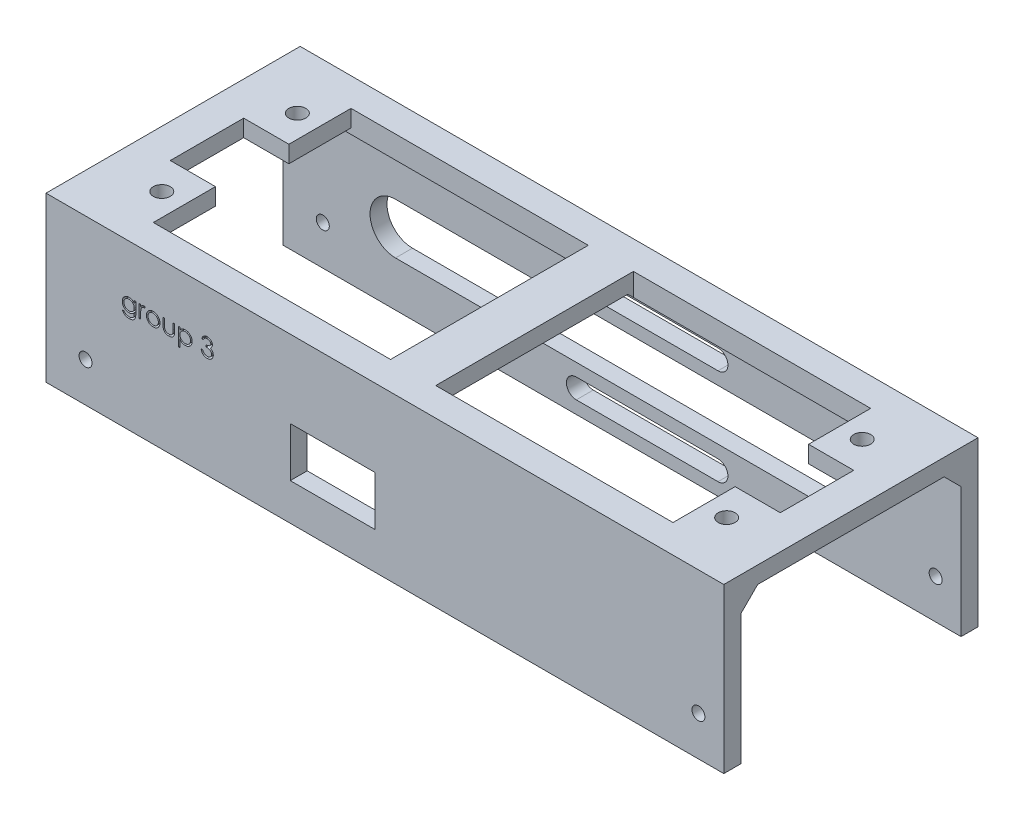
from build123d import *

# Parameters (mm, degrees)
SKETCH1_W           = 120
SKETCH1_H           = 29
BOSS_EXTRUDE5_DEPTH = 45
SHELL9_T            = -3
SKETCH3_R           = 1.15
CUT_EXTRUDE2_DEPTH  = 79
CUT_EXTRUDE8_DEPTH  = 23
SKETCH7_W           = 15
SKETCH7_H           = 8.75
CUT_EXTRUDE9_DEPTH  = 20
SKETCH13_W          = 50
SKETCH13_H          = 35
CUT_EXTRUDE14_DEPTH = 10
CHAMFER2_SIZE       = 3
SKETCH17_W          = 8
SKETCH17_H          = 11
SKETCH17_R          = 1.5
BOSS_EXTRUDE6_DEPTH = 3
CUT_EXTRUDE15_DEPTH = 1.5


with BuildPart() as part:
    # Sketch1 → Boss-Extrude5 (new body)
    with BuildSketch(Plane.XY):
        with Locations((60, 14.5)):
            Rectangle(SKETCH1_W, SKETCH1_H)
    extrude(amount=BOSS_EXTRUDE5_DEPTH)

    # Shell9
    shell9_openings = [part.faces().sort_by_distance(p)[0] for p in [
        (0, 14.5, 22.5),
        (60, 0, 22.5),
        (120, 14.5, 22.5),
    ]]
    offset(amount=SHELL9_T, openings=shell9_openings, kind=Kind.INTERSECTION)

    # Sketch3 → Cut-Extrude2 (cut)
    with BuildSketch(Plane(origin=(0, 0, 0), x_dir=(-1, 0, 0), z_dir=(0, 0, -1))):
        with Locations((-7, 7)):
            Circle(SKETCH3_R)
        with Locations((-115.5, 7)):
            Circle(SKETCH3_R)
    extrude(amount=-CUT_EXTRUDE2_DEPTH, mode=Mode.SUBTRACT)

    # Sketch6 → Cut-Extrude8 (cut)
    with BuildSketch(Plane(origin=(0, 0, 0), x_dir=(-1, 0, 0), z_dir=(0, 0, -1))):
        with BuildLine():
            Line((-76.973496676, 22.75), (-51.883496676, 22.75))
            ThreePointArc((-51.883496676, 22.75), (-50.133496676, 21), (-51.883496676, 19.25))
            Line((-51.883496676, 19.25), (-76.973496676, 19.25))
            ThreePointArc((-76.973496676, 19.25), (-78.723496676, 21), (-76.973496676, 22.75))
        make_face()
        with BuildLine():
            Line((-94.873496676, 17), (-19.873496676, 17))
            ThreePointArc((-19.873496676, 17), (-15.373496676, 12.5), (-19.873496676, 8))
            Line((-19.873496676, 8), (-94.873496676, 8))
            ThreePointArc((-94.873496676, 8), (-99.373496676, 12.5), (-94.873496676, 17))
        make_face()
        with BuildLine():
            Line((-76.973496676, 2.25), (-51.883496676, 2.25))
            ThreePointArc((-51.883496676, 2.25), (-50.133496676, 4), (-51.883496676, 5.75))
            Line((-51.883496676, 5.75), (-76.973496676, 5.75))
            ThreePointArc((-76.973496676, 5.75), (-78.723496676, 4), (-76.973496676, 2.25))
        make_face()
    extrude(amount=-CUT_EXTRUDE8_DEPTH, mode=Mode.SUBTRACT)

    # Sketch7 → Cut-Extrude9 (cut)
    with BuildSketch(Plane.XY.offset(45)):
        with Locations((50.746172795, 10.921245049)):
            Rectangle(SKETCH7_W, SKETCH7_H)
    extrude(amount=-CUT_EXTRUDE9_DEPTH, mode=Mode.SUBTRACT)

    # Sketch13 → Cut-Extrude14 (cut)
    with BuildSketch(Plane(origin=(0, 29, 0), x_dir=(1, 0, 0), z_dir=(0, 1, 0))):
        with Locations((89, -22.5)):
            Rectangle(SKETCH13_W, SKETCH13_H)
        with Locations((31, -22.5)):
            Rectangle(SKETCH13_W, SKETCH13_H)
    extrude(amount=-CUT_EXTRUDE14_DEPTH, mode=Mode.SUBTRACT)

    # Chamfer2
    # the kernel refuses this chamfer: 3 mm, written as the material it adds along each edge
    with BuildSketch(Plane(origin=(120, 26, 42), x_dir=(0, 0.027495876610586768, -0.9996219169112968), z_dir=(-1, 0, 0))) as chamfer2_piece_1_section:
        Polygon((CHAMFER2_SIZE * 0.999621916911, CHAMFER2_SIZE * 0.0274958766106), (-CHAMFER2_SIZE * 0.0274958766106, CHAMFER2_SIZE * 0.999621916911), (0, 0), align=None)
    chamfer2_piece_1 = extrude(amount=127.715048964, mode=Mode.PRIVATE)
    chamfer2_piece_1 = split(chamfer2_piece_1, bisect_by=Plane(origin=(114, 25.666666667, 39.666666667), z_dir=(1, 0, 0)), keep=Keep.TOP, mode=Mode.PRIVATE)
    add(chamfer2_piece_1)
    with BuildSketch(Plane(origin=(127.715048964, 26, 42), x_dir=(0, 0.027495876610586768, -0.9996219169112968), z_dir=(-1, 0, 0))) as chamfer2_piece_2_section:
        Polygon((CHAMFER2_SIZE * 0.999621916911, CHAMFER2_SIZE * 0.0274958766106), (-CHAMFER2_SIZE * 0.0274958766106, CHAMFER2_SIZE * 0.999621916911), (0, 0), align=None)
    chamfer2_piece_2 = extrude(amount=127.715048964, mode=Mode.PRIVATE)
    chamfer2_piece_2 = split(chamfer2_piece_2, bisect_by=Plane(origin=(114, 24.916666667, 41.166666667), z_dir=(-1, 0, 0)), keep=Keep.TOP, mode=Mode.PRIVATE)
    chamfer2_piece_2 = split(chamfer2_piece_2, bisect_by=Plane(origin=(89, 24.916666667, 40), z_dir=(0, 0, 1)), keep=Keep.TOP, mode=Mode.PRIVATE)
    add(chamfer2_piece_2)
    with BuildSketch(Plane(origin=(127.715048964, 26, 42), x_dir=(0, 0.027495876610586768, -0.9996219169112968), z_dir=(-1, 0, 0))) as chamfer2_piece_3_section:
        Polygon((CHAMFER2_SIZE * 0.999621916911, CHAMFER2_SIZE * 0.0274958766106), (-CHAMFER2_SIZE * 0.0274958766106, CHAMFER2_SIZE * 0.999621916911), (0, 0), align=None)
    chamfer2_piece_3 = extrude(amount=135.430097928, mode=Mode.PRIVATE)
    chamfer2_piece_3 = split(chamfer2_piece_3, bisect_by=Plane(origin=(64, 25.666666667, 39.666666667), z_dir=(-1, 0, 0)), keep=Keep.TOP, mode=Mode.PRIVATE)
    chamfer2_piece_3 = split(chamfer2_piece_3, bisect_by=Plane(origin=(56, 25.666666667, 39.666666667), z_dir=(1, 0, 0)), keep=Keep.TOP, mode=Mode.PRIVATE)
    add(chamfer2_piece_3)
    with BuildSketch(Plane(origin=(127.715048964, 26, 42), x_dir=(0, 0.027495876610586768, -0.9996219169112968), z_dir=(-1, 0, 0))) as chamfer2_piece_4_section:
        Polygon((CHAMFER2_SIZE * 0.999621916911, CHAMFER2_SIZE * 0.0274958766106), (-CHAMFER2_SIZE * 0.0274958766106, CHAMFER2_SIZE * 0.999621916911), (0, 0), align=None)
    chamfer2_piece_4 = extrude(amount=127.715048964, mode=Mode.PRIVATE)
    chamfer2_piece_4 = split(chamfer2_piece_4, bisect_by=Plane(origin=(6, 25.666666667, 39.666666667), z_dir=(-1, 0, 0)), keep=Keep.TOP, mode=Mode.PRIVATE)
    add(chamfer2_piece_4)
    with BuildSketch(Plane(origin=(120, 26, 3), x_dir=(0, -0.9996219169112968, -0.027495876610586334), z_dir=(-1, 0, 0))) as chamfer2_piece_5_section:
        Polygon((CHAMFER2_SIZE * 0.999621916911, CHAMFER2_SIZE * 0.0274958766106), (-CHAMFER2_SIZE * 0.0274958766106, CHAMFER2_SIZE * 0.999621916911), (0, 0), align=None)
    chamfer2_piece_5 = extrude(amount=120, mode=Mode.PRIVATE)
    chamfer2_piece_5 = split(chamfer2_piece_5, bisect_by=Plane(origin=(117, 24.916666667, 5), z_dir=(0, 0, -1)), keep=Keep.TOP, mode=Mode.PRIVATE)
    add(chamfer2_piece_5)
    with BuildSketch(Plane(origin=(120, 26, 3), x_dir=(0, -0.9996219169112968, -0.027495876610586334), z_dir=(-1, 0, 0))) as chamfer2_piece_6_section:
        Polygon((CHAMFER2_SIZE * 0.999621916911, CHAMFER2_SIZE * 0.0274958766106), (-CHAMFER2_SIZE * 0.0274958766106, CHAMFER2_SIZE * 0.999621916911), (0, 0), align=None)
    chamfer2_piece_6 = extrude(amount=127.715048964, mode=Mode.PRIVATE)
    chamfer2_piece_6 = split(chamfer2_piece_6, bisect_by=Plane(origin=(114, 25.666666667, 5.333333333), z_dir=(1, 0, 0)), keep=Keep.TOP, mode=Mode.PRIVATE)
    add(chamfer2_piece_6)
    with BuildSketch(Plane(origin=(127.715048964, 26, 3), x_dir=(0, -0.9996219169112968, -0.027495876610586334), z_dir=(-1, 0, 0))) as chamfer2_piece_7_section:
        Polygon((CHAMFER2_SIZE * 0.999621916911, CHAMFER2_SIZE * 0.0274958766106), (-CHAMFER2_SIZE * 0.0274958766106, CHAMFER2_SIZE * 0.999621916911), (0, 0), align=None)
    chamfer2_piece_7 = extrude(amount=135.430097928, mode=Mode.PRIVATE)
    chamfer2_piece_7 = split(chamfer2_piece_7, bisect_by=Plane(origin=(64, 25.666666667, 5.333333333), z_dir=(-1, 0, 0)), keep=Keep.TOP, mode=Mode.PRIVATE)
    chamfer2_piece_7 = split(chamfer2_piece_7, bisect_by=Plane(origin=(56, 25.666666667, 5.333333333), z_dir=(1, 0, 0)), keep=Keep.TOP, mode=Mode.PRIVATE)
    add(chamfer2_piece_7)
    with BuildSketch(Plane(origin=(127.715048964, 26, 3), x_dir=(0, -0.9996219169112968, -0.027495876610586334), z_dir=(-1, 0, 0))) as chamfer2_piece_8_section:
        Polygon((CHAMFER2_SIZE * 0.999621916911, CHAMFER2_SIZE * 0.0274958766106), (-CHAMFER2_SIZE * 0.0274958766106, CHAMFER2_SIZE * 0.999621916911), (0, 0), align=None)
    chamfer2_piece_8 = extrude(amount=127.715048964, mode=Mode.PRIVATE)
    chamfer2_piece_8 = split(chamfer2_piece_8, bisect_by=Plane(origin=(6, 25.666666667, 5.333333333), z_dir=(-1, 0, 0)), keep=Keep.TOP, mode=Mode.PRIVATE)
    add(chamfer2_piece_8)

    # Sketch17 → Boss-Extrude6 (add)
    # profile 1 of 4: a face of its own
    with BuildSketch(Plane(origin=(0, 29, 0), x_dir=(1, 0, 0), z_dir=(0, 1, 0))):
        with Locations((10, -10.5)):
            Rectangle(SKETCH17_W, SKETCH17_H)
        with Locations(Location((10, -10.5, 0), (0, 0, 270))):
            Circle(SKETCH17_R, mode=Mode.SUBTRACT)
    # profile 2 of 4: a face of its own
    with BuildSketch(Plane(origin=(0, 29, 0), x_dir=(1, 0, 0), z_dir=(0, 1, 0))):
        with Locations((10, -34.5)):
            Rectangle(SKETCH17_W, SKETCH17_H)
        with Locations(Location((10, -34.5, 0), (0, 0, 270))):
            Circle(SKETCH17_R, mode=Mode.SUBTRACT)
    # profile 3 of 4: a face of its own
    with BuildSketch(Plane(origin=(0, 29, 0), x_dir=(1, 0, 0), z_dir=(0, 1, 0))):
        with Locations((110, -10.5)):
            Rectangle(SKETCH17_W, SKETCH17_H)
        with Locations(Location((110, -10.5, 0), (0, 0, 270))):
            Circle(SKETCH17_R, mode=Mode.SUBTRACT)
    # profile 4 of 4: a face of its own
    with BuildSketch(Plane(origin=(0, 29, 0), x_dir=(1, 0, 0), z_dir=(0, 1, 0))):
        with Locations((110, -34.5)):
            Rectangle(SKETCH17_W, SKETCH17_H)
        with Locations(Location((110, -34.5, 0), (0, 0, 270))):
            Circle(SKETCH17_R, mode=Mode.SUBTRACT)
    extrude(amount=-BOSS_EXTRUDE6_DEPTH)

    # Sketch20 → Cut-Extrude15 (cut)
    # profile 1 of 6: a face of its own
    with BuildSketch(Plane.XY.offset(45)):
        with BuildLine():
            Line((15.616704574, 20.332761713), (15.901640472, 20.332761713))
            Line((15.901640472, 20.332761713), (15.901640472, 18.49149068))
            add(Edge.make_bspline(
                [(15.901640472, 18.49149068), (15.901389155, 18.452268005), (15.900904052, 18.376558794), (15.897410671, 18.267086354), (15.890044057, 18.165970691), (15.881690467, 18.072750642), (15.869673803, 17.9878583), (15.854999527, 17.91104035), (15.838457161, 17.842223075), (15.823924535, 17.799836969), (15.817050127, 17.779786954)],
                knots=[0, 0, 0, 0, 1.307562039, 2.523909702, 3.650326591, 4.686913197, 5.643429486, 6.506965704, 7.293745905, 8, 8, 8, 8], degree=3))
            add(Edge.make_bspline(
                [(15.817050127, 17.779786954), (15.806899889, 17.753724811), (15.786902899, 17.702379766), (15.749450931, 17.629595775), (15.707510176, 17.561064407), (15.659606909, 17.497167576), (15.605957751, 17.438226048), (15.547826683, 17.382959277), (15.484081581, 17.332536497), (15.414758892, 17.287827692), (15.341456639, 17.247562292), (15.264216961, 17.212685764), (15.183475406, 17.182308413), (15.098473497, 17.159554734), (15.010543928, 17.139838237), (14.918652687, 17.127006986), (14.823336649, 17.118273869), (14.758525483, 17.117466301), (14.725643877, 17.117056585)],
                knots=[0, 0, 0, 0, 0.981931301, 1.934503488, 2.87077864, 3.801706999, 4.735015492, 5.667491629, 6.616593066, 7.585388521, 8.561939025, 9.551802639, 10.560317337, 11.588439944, 12.640189604, 13.723962949, 14.845264515, 16, 16, 16, 16], degree=3))
            add(Edge.make_bspline(
                [(14.725643877, 17.117056585), (14.677669868, 17.11783354), (14.583963739, 17.119351142), (14.447343495, 17.137032186), (14.317590571, 17.162027939), (14.196419457, 17.19986072), (14.084595869, 17.246158561), (13.982883496, 17.299312554), (13.89219542, 17.360262855), (13.810440374, 17.429659829), (13.736651931, 17.512176883), (13.667230747, 17.609421549), (13.600409749, 17.722875084), (13.561249628, 17.806144188), (13.540743036, 17.849748893)],
                knots=[0, 0, 0, 0, 1.157897085, 2.2616841, 3.32207898, 4.345638746, 5.321241055, 6.241986252, 7.112515963, 7.955008012, 8.825025602, 9.77857164, 10.836726669, 12, 12, 12, 12], degree=3))
            Line((13.540743036, 17.849748893), (13.825678933, 17.849748893))
            add(Edge.make_bspline(
                [(13.825678933, 17.849748893), (13.848595366, 17.813367134), (13.89339417, 17.742245276), (13.977167435, 17.650158342), (14.068976031, 17.571460647), (14.171918315, 17.508041587), (14.286422618, 17.460226276), (14.412557826, 17.426140115), (14.55135034, 17.405732787), (14.647977577, 17.403273256), (14.698295119, 17.401992483)],
                knots=[0, 0, 0, 0, 0.997731894, 1.950442991, 2.880492273, 3.800895997, 4.748200782, 5.754801363, 6.83083817, 8, 8, 8, 8], degree=3))
            add(Edge.make_bspline(
                [(14.698295119, 17.401992483), (14.747976513, 17.403289832), (14.843757266, 17.405790991), (14.981489827, 17.426149222), (15.107215235, 17.460233694), (15.220209131, 17.507957016), (15.319138293, 17.566422742), (15.404420599, 17.631737095), (15.473494698, 17.705379862), (15.519952175, 17.773217644), (15.548830721, 17.833655247), (15.567220536, 17.885682245), (15.582164779, 17.944513069), (15.594665061, 18.009950487), (15.604980103, 18.08208799), (15.611514147, 18.161090521), (15.616236561, 18.246778529), (15.616544963, 18.306190162), (15.616704574, 18.336938396)],
                knots=[0, 0, 0, 0, 1.570740765, 3.028230971, 4.391408896, 5.680370741, 6.894727393, 8.017376726, 9.065722033, 10.075533815, 10.603371122, 11.180248986, 11.817768598, 12.521299649, 13.286540596, 14.121245857, 15.027658897, 16, 16, 16, 16], degree=3))
            Line((15.616704574, 18.336938396), (15.616704574, 18.457145728))
            add(Edge.make_bspline(
                [(15.616704574, 18.457145728), (15.587783846, 18.422727093), (15.530451097, 18.354495237), (15.431438879, 18.265085752), (15.323292106, 18.188081905), (15.206194892, 18.124927858), (15.083015558, 18.074416852), (14.955088249, 18.039090023), (14.823559742, 18.016266399), (14.734431006, 18.013810477), (14.689390872, 18.012569406)],
                knots=[0, 0, 0, 0, 1.012485704, 2.007162095, 2.997754123, 3.998611389, 4.999708251, 5.992315798, 6.98544096, 8, 8, 8, 8], degree=3))
            add(Edge.make_bspline(
                [(14.689390872, 18.012569406), (14.662869399, 18.013036608), (14.610140308, 18.013965485), (14.531804216, 18.022092376), (14.454624104, 18.033884092), (14.378779973, 18.051193683), (14.304162381, 18.073411178), (14.230894637, 18.101184934), (14.158383509, 18.132585791), (14.087947043, 18.169572548), (14.020286767, 18.210722641), (13.955913021, 18.255298635), (13.895162989, 18.303067225), (13.838614888, 18.354499449), (13.786342893, 18.409520868), (13.737643956, 18.467544948), (13.693323362, 18.52938192), (13.652471645, 18.593904232), (13.617040867, 18.661541641), (13.585940044, 18.730827485), (13.558898655, 18.801613615), (13.537340041, 18.874137022), (13.520874388, 18.948351984), (13.508618682, 19.02413692), (13.501667308, 19.1017252), (13.500583341, 19.153995995), (13.500037908, 19.180297771)],
                knots=[0, 0, 0, 0, 1.028754217, 2.045334182, 3.052854819, 4.056607503, 5.061168794, 6.071104265, 7.095078842, 8.125279047, 9.155117945, 10.165957491, 11.161587969, 12.151493252, 13.128948131, 14.104219989, 15.088194871, 16.07871515, 17.064853787, 18.047899887, 19.02414258, 20.002704429, 20.980574569, 21.971845993, 22.979467364, 24, 24, 24, 24], degree=3))
            add(Edge.make_bspline(
                [(13.500037908, 19.180297771), (13.500508866, 19.206607723), (13.501448958, 19.259125723), (13.509568775, 19.337030594), (13.521151346, 19.413892296), (13.53948268, 19.488918582), (13.561546682, 19.562963892), (13.588873066, 19.635481306), (13.621728655, 19.706492911), (13.658930356, 19.776051293), (13.700735212, 19.843223058), (13.746575391, 19.907019373), (13.796506234, 19.966970786), (13.8498389, 20.023682111), (13.907224591, 20.07660618), (13.96863362, 20.125614541), (14.033460661, 20.171528693), (14.101906631, 20.213358264), (14.172915405, 20.250353587), (14.24468294, 20.284110729), (14.31815991, 20.310902394), (14.391976428, 20.334509063), (14.467432493, 20.351232418), (14.543602915, 20.364134024), (14.620748464, 20.371994163), (14.672412876, 20.372975315), (14.698295119, 20.373466842)],
                knots=[0, 0, 0, 0, 1.008818848, 2.013730394, 3.001654427, 3.987803273, 4.973046549, 5.963777569, 6.957074694, 7.972068341, 8.987420212, 9.989399531, 10.982630087, 11.977756091, 12.973280677, 13.973972381, 14.989194003, 16.018387222, 17.047741039, 18.059210846, 19.057554164, 20.045176975, 21.029480261, 22.018708529, 23.007435371, 24, 24, 24, 24], degree=3))
            add(Edge.make_bspline(
                [(14.698295119, 20.373466842), (14.740977042, 20.372236145), (14.825260726, 20.369805898), (14.949295278, 20.350736716), (15.068985739, 20.320334718), (15.18500751, 20.276777682), (15.298305708, 20.217314433), (15.408506924, 20.138989044), (15.515929996, 20.04109895), (15.582222028, 19.966030281), (15.616704574, 19.926982467)],
                knots=[0, 0, 0, 0, 0.96728863, 1.910097829, 2.838038873, 3.762875196, 4.71315279, 5.730631239, 6.819562287, 8, 8, 8, 8], degree=3))
            Line((15.616704574, 19.926982467), (15.616704574, 20.332761713))
        make_face()
        with BuildLine():
            add(Edge.make_bspline(
                [(14.721191754, 20.088530944), (14.679526044, 20.087114835), (14.597036773, 20.084311238), (14.476125205, 20.060376534), (14.359396844, 20.022869897), (14.249083349, 19.969219095), (14.145753328, 19.903819322), (14.054064026, 19.824589204), (13.973868138, 19.734105154), (13.90602933, 19.633185287), (13.852025876, 19.524307938), (13.813795774, 19.409544629), (13.78907611, 19.290749742), (13.78634774, 19.209676024), (13.784973805, 19.168849454)],
                knots=[0, 0, 0, 0, 1.026226791, 2.031711442, 3.026614839, 4.04107745, 5.047145931, 6.032893242, 7.017642609, 8.019221815, 9.021877557, 10.003543541, 10.994637589, 12, 12, 12, 12], degree=3))
            add(Edge.make_bspline(
                [(13.784973805, 19.168849454), (13.78563217, 19.138067128), (13.786926982, 19.077527295), (13.799376227, 18.988683633), (13.819497532, 18.904065063), (13.848015569, 18.823666466), (13.883351228, 18.747026688), (13.927794307, 18.674673668), (13.980091974, 18.60654297), (14.039834895, 18.543138509), (14.105672041, 18.485388916), (14.177081601, 18.434645122), (14.25396672, 18.393142682), (14.334436469, 18.357273494), (14.42044337, 18.331076054), (14.510748612, 18.311083733), (14.605991079, 18.299645788), (14.670916871, 18.298228108), (14.704019278, 18.297505303)],
                knots=[0, 0, 0, 0, 1.039728707, 2.044842319, 3.024901384, 3.974314358, 4.923051295, 5.871625912, 6.837440708, 7.820715446, 8.810779094, 9.792721783, 10.773906224, 11.758876063, 12.764959493, 13.806266761, 14.881525401, 16, 16, 16, 16], degree=3))
            add(Edge.make_bspline(
                [(14.704019278, 18.297505303), (14.737550687, 18.298201634), (14.803121003, 18.299563302), (14.898888923, 18.311268619), (14.989632909, 18.330157126), (15.075269755, 18.356975013), (15.1561228, 18.39119403), (15.231283772, 18.434497961), (15.302364264, 18.483814268), (15.367094722, 18.541338023), (15.425627358, 18.604733697), (15.476636696, 18.673717281), (15.520101946, 18.747250752), (15.556095261, 18.825325821), (15.583573711, 18.908549241), (15.60200586, 18.996712964), (15.614893407, 19.089394606), (15.616091675, 19.152902422), (15.616704574, 19.185385912)],
                knots=[0, 0, 0, 0, 1.121943988, 2.193949579, 3.223793937, 4.220241907, 5.192961521, 6.155822191, 7.11847367, 8.083710714, 9.04790392, 10.001595906, 10.949595423, 11.902125208, 12.873731292, 13.87582262, 14.913508608, 16, 16, 16, 16], degree=3))
            add(Edge.make_bspline(
                [(15.616704574, 19.185385912), (15.615489395, 19.227674965), (15.613115361, 19.310292915), (15.59071151, 19.430676912), (15.554588891, 19.543859923), (15.503927909, 19.649483987), (15.440444229, 19.746429935), (15.363980388, 19.83290228), (15.27585506, 19.909012343), (15.176321441, 19.97241999), (15.069235544, 20.023642205), (14.957184173, 20.062070384), (14.840333683, 20.083836656), (14.761134297, 20.086957176), (14.721191754, 20.088530944)],
                knots=[0, 0, 0, 0, 1.070913519, 2.092188694, 3.091357305, 4.074328408, 5.051968682, 6.018948707, 6.99050112, 7.9935919, 9.000589572, 9.992915277, 10.987769056, 12, 12, 12, 12], degree=3))
        make_face(mode=Mode.SUBTRACT)
    # profile 2 of 6: a face of its own
    with BuildSketch(Plane.XY.offset(45)):
        with BuildLine():
            Line((16.471512267, 20.332761713), (16.756448164, 20.332761713))
            Line((16.756448164, 20.332761713), (16.756448164, 19.991220247))
            add(Edge.make_bspline(
                [(16.756448164, 19.991220247), (16.777483681, 20.023020891), (16.817713944, 20.083839376), (16.884582101, 20.1642751), (16.953074409, 20.230873035), (17.023518757, 20.283944084), (17.096433176, 20.323688842), (17.170217411, 20.352801809), (17.246032302, 20.370016945), (17.29697919, 20.372315336), (17.322503853, 20.373466842)],
                knots=[0, 0, 0, 0, 1.2804753, 2.448899062, 3.506932113, 4.484331642, 5.4025378, 6.288909075, 7.142734305, 8, 8, 8, 8], degree=3))
            add(Edge.make_bspline(
                [(17.322503853, 20.373466842), (17.342303449, 20.372386864), (17.383042405, 20.37016474), (17.444712326, 20.354552063), (17.508251743, 20.329625571), (17.549202337, 20.306184798), (17.570550728, 20.293964638)],
                knots=[0, 0, 0, 0, 0.901110191, 1.854092781, 2.881294221, 4, 4, 4, 4], degree=3))
            Line((17.570550728, 20.293964638), (17.414090392, 20.047189798))
            add(Edge.make_bspline(
                [(17.414090392, 20.047189798), (17.400384351, 20.053304183), (17.374367662, 20.064910455), (17.336308877, 20.078646421), (17.301219379, 20.08673443), (17.278864151, 20.087959724), (17.268442355, 20.088530944)],
                knots=[0, 0, 0, 0, 1.180555205, 2.24091978, 3.179933427, 4, 4, 4, 4], degree=3))
            add(Edge.make_bspline(
                [(17.268442355, 20.088530944), (17.245577154, 20.08700691), (17.198938771, 20.083898323), (17.130463547, 20.059460976), (17.064017868, 20.019977365), (17.01124786, 19.976188571), (16.970388102, 19.933963069), (16.941232326, 19.897089161), (16.914487262, 19.855742831), (16.888932848, 19.810630903), (16.865649853, 19.760983115), (16.843919546, 19.707295485), (16.824271863, 19.649505833), (16.813068427, 19.609244546), (16.807329574, 19.588621088)],
                knots=[0, 0, 0, 0, 1.125678352, 2.296057538, 3.5422874, 4.923748041, 5.663163013, 6.437101912, 7.23742474, 8.08941207, 8.991984279, 9.93940061, 10.944477711, 12, 12, 12, 12], degree=3))
            add(Edge.make_bspline(
                [(16.807329574, 19.588621088), (16.803036618, 19.570226795), (16.793528044, 19.529484834), (16.784282864, 19.461132958), (16.775148372, 19.380375782), (16.768710726, 19.286988515), (16.762743502, 19.18120437), (16.759377927, 19.06286219), (16.756562935, 18.931840507), (16.756487582, 18.840242344), (16.756448164, 18.792327018)],
                knots=[0, 0, 0, 0, 0.566838948, 1.255505196, 2.06880316, 3.007127437, 4.065329342, 5.249902469, 6.561414163, 8, 8, 8, 8], degree=3))
            Line((16.756448164, 18.792327018), (16.756448164, 18.012569406))
            Line((16.756448164, 18.012569406), (16.471512267, 18.012569406))
            Line((16.471512267, 18.012569406), (16.471512267, 20.332761713))
        make_face()
    # profile 3 of 6: a face of its own
    with BuildSketch(Plane.XY.offset(45)):
        with BuildLine():
            add(Edge.make_bspline(
                [(18.976149687, 20.373466842), (19.019684627, 20.37253984), (19.105046006, 20.370722218), (19.230057445, 20.351295784), (19.349387675, 20.321589247), (19.463493721, 20.280521473), (19.570914218, 20.225474275), (19.673213846, 20.159788703), (19.770112133, 20.081971636), (19.828190167, 20.021775389), (19.857670119, 19.991220247)],
                knots=[0, 0, 0, 0, 1.054011418, 2.066658804, 3.057071809, 4.030435133, 4.997543892, 5.974964718, 6.972108034, 8, 8, 8, 8], degree=3))
            add(Edge.make_bspline(
                [(19.857670119, 19.991220247), (19.883053749, 19.96199756), (19.933329765, 19.904117725), (19.997796525, 19.810268705), (20.053333226, 19.713077328), (20.09784034, 19.611252967), (20.132933183, 19.505684516), (20.157848493, 19.39600912), (20.172668427, 19.282468991), (20.174666833, 19.205358366), (20.175678933, 19.166305383)],
                knots=[0, 0, 0, 0, 1.025258237, 2.030674902, 3.01204498, 3.988269485, 4.97094183, 5.956517959, 6.965070386, 8, 8, 8, 8], degree=3))
            add(Edge.make_bspline(
                [(20.175678933, 19.166305383), (20.17478872, 19.127026045), (20.173029618, 19.049408242), (20.156389337, 18.935090674), (20.130507566, 18.824242513), (20.093467256, 18.717327841), (20.045970971, 18.614019848), (19.98801299, 18.514769757), (19.919186595, 18.41938175), (19.841168683, 18.328665797), (19.754943053, 18.245057873), (19.661401975, 18.172188657), (19.562383673, 18.109757703), (19.456571489, 18.059468955), (19.344931697, 18.019818012), (19.227223499, 17.991968712), (19.103629757, 17.975130613), (19.019240778, 17.972968371), (18.976149687, 17.971864278)],
                knots=[0, 0, 0, 0, 0.998656419, 1.973391657, 2.932242238, 3.890759089, 4.846373663, 5.82037756, 6.809684879, 7.83454468, 8.860553229, 9.859544525, 10.845671541, 11.83227036, 12.833544569, 13.85385346, 14.904124723, 16, 16, 16, 16], degree=3))
            add(Edge.make_bspline(
                [(18.976149687, 17.971864278), (18.932847477, 17.972972077), (18.848037911, 17.975141758), (18.724007913, 17.991903293), (18.606088759, 18.019805177), (18.494302816, 18.05959926), (18.388035705, 18.10975931), (18.288443668, 18.171999915), (18.194826602, 18.245079484), (18.10858273, 18.328659941), (18.03056971, 18.419383259), (17.961742052, 18.514769365), (17.903784399, 18.61401995), (17.856288029, 18.717327814), (17.819247741, 18.824242521), (17.793365964, 18.935090672), (17.776725685, 19.049408242), (17.774966583, 19.127026045), (17.774076369, 19.166305383)],
                knots=[0, 0, 0, 0, 1.099876186, 2.154163076, 3.173186993, 4.173200201, 5.163417411, 6.152872554, 7.150605724, 8.17532212, 9.198891216, 10.186952605, 11.159729845, 12.11414092, 13.071450619, 14.029093627, 15.002601286, 16, 16, 16, 16], degree=3))
            add(Edge.make_bspline(
                [(17.774076369, 19.166305383), (17.775095372, 19.205146107), (17.777112823, 19.282044065), (17.791917856, 19.395370756), (17.816735975, 19.50486053), (17.851870885, 19.610021498), (17.896788237, 19.711399643), (17.951544548, 19.808831168), (18.016668907, 19.902255816), (18.066744963, 19.960060846), (18.092085183, 19.989312194)],
                knots=[0, 0, 0, 0, 1.031353054, 2.041901799, 3.029428768, 4.008703097, 4.981709435, 5.96992636, 6.972712378, 8, 8, 8, 8], degree=3))
            add(Edge.make_bspline(
                [(18.092085183, 19.989312194), (18.121520691, 20.020132318), (18.179410796, 20.080745514), (18.276791428, 20.158335732), (18.378839394, 20.22538817), (18.487447005, 20.279341594), (18.601459312, 20.321830821), (18.721401054, 20.351372396), (18.8468367, 20.370652225), (18.932615785, 20.372519286), (18.976149687, 20.373466842)],
                knots=[0, 0, 0, 0, 1.027980169, 2.021703884, 2.998553061, 3.971491411, 4.943284454, 5.930300938, 6.949603206, 8, 8, 8, 8], degree=3))
        make_face()
        with BuildLine():
            add(Edge.make_bspline(
                [(18.974877651, 20.088530944), (18.94409139, 20.087655922), (18.883313609, 20.085928465), (18.793851557, 20.072789495), (18.707727274, 20.05197283), (18.624777366, 20.022396294), (18.545281559, 19.984206578), (18.469163744, 19.937299709), (18.396200031, 19.882296955), (18.327817731, 19.819284389), (18.26505949, 19.750451301), (18.210197326, 19.67711029), (18.163547408, 19.600450961), (18.124685264, 19.520393598), (18.095740886, 19.436126908), (18.074719644, 19.348605193), (18.061593069, 19.257650137), (18.059881854, 19.195818356), (18.059012267, 19.16439733)],
                knots=[0, 0, 0, 0, 1.021534396, 2.016698045, 2.994645724, 3.958388632, 4.93408049, 5.916473867, 6.921342795, 7.962252576, 8.998418191, 10.008913653, 10.997312074, 11.973003931, 12.956656626, 13.948281152, 14.957379055, 16, 16, 16, 16], degree=3))
            add(Edge.make_bspline(
                [(18.059012267, 19.16439733), (18.060469885, 19.123800849), (18.063362986, 19.043224424), (18.08688995, 18.924560048), (18.126247504, 18.810639368), (18.179394536, 18.702130218), (18.245984463, 18.601734651), (18.324440588, 18.512225519), (18.413920888, 18.434949819), (18.513358713, 18.370832194), (18.620722987, 18.319887273), (18.734348364, 18.283783917), (18.852858136, 18.260314596), (18.933848514, 18.257981901), (18.974877651, 18.256800175)],
                knots=[0, 0, 0, 0, 1.016792936, 2.018143844, 3.017858371, 4.030088057, 5.03801393, 6.028138512, 7.003788237, 7.991172063, 8.984598303, 9.972568034, 10.972917682, 12, 12, 12, 12], degree=3))
            add(Edge.make_bspline(
                [(18.974877651, 18.256800175), (19.015904429, 18.257988786), (19.096890148, 18.260335072), (19.215235258, 18.283665716), (19.328550076, 18.320045465), (19.435802834, 18.370774898), (19.535195396, 18.435193303), (19.625319242, 18.51178916), (19.703105482, 18.601971725), (19.769629538, 18.702263197), (19.82364694, 18.810471145), (19.862820273, 18.924581074), (19.886403798, 19.043219069), (19.889289264, 19.123799055), (19.890743036, 19.16439733)],
                knots=[0, 0, 0, 0, 1.02726834, 2.027799167, 3.010890988, 4.004497153, 4.992059811, 5.971914811, 6.958719428, 7.966827853, 8.981595046, 9.981490638, 10.983022906, 12, 12, 12, 12], degree=3))
            add(Edge.make_bspline(
                [(19.890743036, 19.16439733), (19.889873748, 19.195818544), (19.888163122, 19.257650694), (19.875032262, 19.348603063), (19.854026879, 19.436134725), (19.825024055, 19.520364757), (19.786330771, 19.600658243), (19.738781252, 19.67688521), (19.684143107, 19.750705362), (19.620627576, 19.819061879), (19.552316655, 19.882321519), (19.47932337, 19.937321037), (19.403318425, 19.984000427), (19.324053568, 20.022722945), (19.241093025, 20.051703747), (19.155089415, 20.072909691), (19.066009066, 20.085872941), (19.005449077, 20.087639276), (18.974877651, 20.088530944)],
                knots=[0, 0, 0, 0, 1.042956736, 2.052379634, 3.044323526, 4.02829302, 5.004299113, 5.996692471, 7.007513377, 8.048758398, 9.090003419, 10.095195979, 11.07790575, 12.047570684, 13.018257071, 13.989683339, 14.985167495, 16, 16, 16, 16], degree=3))
        make_face(mode=Mode.SUBTRACT)
    # profile 4 of 6: a face of its own
    with BuildSketch(Plane.XY.offset(45)):
        with BuildLine():
            Line((20.7048456, 20.332761713), (20.989781497, 20.332761713))
            Line((20.989781497, 20.332761713), (20.989781497, 19.256619887))
            add(Edge.make_bspline(
                [(20.989781497, 19.256619887), (20.989910225, 19.225030678), (20.990156476, 19.164602003), (20.991826473, 19.077647655), (20.995754486, 18.998348208), (21.000665598, 18.926657854), (21.00698125, 18.86258872), (21.014495442, 18.806364589), (21.022894153, 18.757347865), (21.031115329, 18.727826393), (21.034938749, 18.71409685)],
                knots=[0, 0, 0, 0, 1.388932606, 2.656963016, 3.823490214, 4.879454478, 5.816252168, 6.653371382, 7.373723809, 8, 8, 8, 8], degree=3))
            add(Edge.make_bspline(
                [(21.034938749, 18.71409685), (21.041072355, 18.696840388), (21.05321205, 18.662686223), (21.075231567, 18.613347625), (21.102471558, 18.567650048), (21.132280116, 18.523831353), (21.166660293, 18.483189551), (21.205177099, 18.445793272), (21.246541214, 18.410229561), (21.3080047, 18.368151928), (21.392059891, 18.323053022), (21.502416319, 18.284140387), (21.622072295, 18.260885035), (21.704771719, 18.258186961), (21.747278493, 18.256800175)],
                knots=[0, 0, 0, 0, 0.725840625, 1.436591201, 2.137033971, 2.831655856, 3.53531722, 4.242432219, 4.957935707, 5.694543706, 7.190802206, 8.724350549, 10.316345118, 12, 12, 12, 12], degree=3))
            add(Edge.make_bspline(
                [(21.747278493, 18.256800175), (21.789781318, 18.258216451), (21.872016419, 18.260956682), (21.990357713, 18.283438892), (22.098535782, 18.320999767), (22.195464859, 18.373439347), (22.2807053, 18.437612504), (22.351738594, 18.512913352), (22.410346603, 18.596959582), (22.435936578, 18.659665178), (22.448805937, 18.691200215)],
                knots=[0, 0, 0, 0, 1.157059328, 2.238695713, 3.266970494, 4.264342957, 5.228770407, 6.160125903, 7.074715775, 8, 8, 8, 8], degree=3))
            add(Edge.make_bspline(
                [(22.448805937, 18.691200215), (22.452610702, 18.703869643), (22.46102211, 18.731878654), (22.470059386, 18.779394569), (22.478200505, 18.836058889), (22.485152101, 18.902242407), (22.490109784, 18.977772166), (22.492782251, 19.062624564), (22.495801472, 19.156533227), (22.495847297, 19.222271837), (22.495871241, 19.256619887)],
                knots=[0, 0, 0, 0, 0.557542046, 1.232589297, 2.036731608, 2.971723315, 4.038036528, 5.22795436, 6.551621927, 8, 8, 8, 8], degree=3))
            Line((22.495871241, 19.256619887), (22.495871241, 20.332761713))
            Line((22.495871241, 20.332761713), (22.780807138, 20.332761713))
            Line((22.780807138, 20.332761713), (22.780807138, 19.203194406))
            add(Edge.make_bspline(
                [(22.780807138, 19.203194406), (22.780406458, 19.164815757), (22.779629084, 19.09035593), (22.774633136, 18.9821482), (22.766060988, 18.881308163), (22.753050123, 18.787782443), (22.737750547, 18.701642441), (22.7180145, 18.622777758), (22.694448527, 18.551431377), (22.667864238, 18.486351337), (22.636457258, 18.427344511), (22.60304989, 18.371341306), (22.564473847, 18.319731286), (22.523860848, 18.269945348), (22.478683632, 18.224459819), (22.42978876, 18.18223098), (22.377864429, 18.142613302), (22.321758371, 18.107151927), (22.262289657, 18.075205398), (22.199384872, 18.046887956), (22.132273538, 18.02447919), (22.061821525, 18.005147372), (21.98768366, 17.98998496), (21.909931418, 17.97929286), (21.828590988, 17.972738453), (21.773155978, 17.972160562), (21.744734422, 17.971864278)],
                knots=[0, 0, 0, 0, 1.493040784, 2.896703357, 4.213163133, 5.428574705, 6.569057535, 7.615249723, 8.588095153, 9.490268104, 10.346124644, 11.18633936, 12.024365274, 12.850166724, 13.684164916, 14.514361689, 15.362232829, 16.222528818, 17.093394965, 17.986930858, 18.902426812, 19.842810585, 20.827885679, 21.843828298, 22.894529745, 24, 24, 24, 24], degree=3))
            add(Edge.make_bspline(
                [(21.744734422, 17.971864278), (21.716525441, 17.97217244), (21.661092168, 17.972778009), (21.57974754, 17.979256649), (21.501779875, 17.989968347), (21.427466371, 18.005258437), (21.356732454, 18.024343879), (21.289291607, 18.047025657), (21.225933518, 18.075220094), (21.165896986, 18.106949736), (21.109651962, 18.142841093), (21.056939181, 18.1821821), (21.007829322, 18.224914029), (20.962311553, 18.270858417), (20.921024781, 18.320585209), (20.883454515, 18.373694396), (20.849022361, 18.429659748), (20.817859472, 18.489588474), (20.791088094, 18.555421654), (20.767452264, 18.628262592), (20.748120471, 18.708909875), (20.732388374, 18.797294553), (20.719732425, 18.892993627), (20.71094571, 18.996560689), (20.706032778, 19.107743467), (20.705249858, 19.18453301), (20.7048456, 19.224182988)],
                knots=[0, 0, 0, 0, 1.083640291, 2.129454052, 3.13281866, 4.105697902, 5.042300162, 5.946461698, 6.836384745, 7.703652036, 8.553297018, 9.397182691, 10.228592656, 11.052265423, 11.879314572, 12.708807002, 13.549817954, 14.402308542, 15.300838682, 16.27712199, 17.341985831, 18.484375296, 19.725102775, 21.0496083, 22.476576903, 24, 24, 24, 24], degree=3))
            Line((20.7048456, 19.224182988), (20.7048456, 20.332761713))
        make_face()
    # profile 5 of 6: a face of its own
    with BuildSketch(Plane.XY.offset(45)):
        with BuildLine():
            Line((23.43208919, 20.332761713), (23.717025087, 20.332761713))
            Line((23.717025087, 20.332761713), (23.717025087, 19.903449814))
            add(Edge.make_bspline(
                [(23.717025087, 19.903449814), (23.747285091, 19.942400473), (23.806089351, 20.018093283), (23.907439801, 20.116055757), (24.014416263, 20.198674068), (24.129771645, 20.263428223), (24.251713135, 20.312251388), (24.379740309, 20.348337032), (24.51493976, 20.369601798), (24.607374399, 20.372161448), (24.654515071, 20.373466842)],
                knots=[0, 0, 0, 0, 1.0828784, 2.104357462, 3.088488658, 4.04616522, 5.001424249, 5.969181776, 6.964304535, 8, 8, 8, 8], degree=3))
            add(Edge.make_bspline(
                [(24.654515071, 20.373466842), (24.69569174, 20.372275601), (24.777079588, 20.369921051), (24.896879803, 20.35397978), (25.012246044, 20.32665873), (25.122525636, 20.2872879), (25.228899988, 20.238614724), (25.329794321, 20.177185698), (25.42678019, 20.106060082), (25.517418447, 20.024206631), (25.601167116, 19.935643847), (25.673599009, 19.840373614), (25.736075665, 19.741528982), (25.786576577, 19.637577584), (25.826135578, 19.529337997), (25.854270321, 19.416372911), (25.87101404, 19.299101165), (25.873260536, 19.21936084), (25.874396882, 19.179025736)],
                knots=[0, 0, 0, 0, 1.041296284, 2.058176809, 3.050446431, 4.034000596, 5.01514041, 6.003636468, 7.015969324, 8.052561599, 9.08815499, 10.094063707, 11.074456064, 12.040834395, 13.011057502, 13.983766392, 14.980127149, 16, 16, 16, 16], degree=3))
            add(Edge.make_bspline(
                [(25.874396882, 19.179025736), (25.873285192, 19.137839356), (25.871092778, 19.056613871), (25.854088379, 18.93733629), (25.826913215, 18.822594172), (25.787853292, 18.712578369), (25.737378513, 18.607364628), (25.675960805, 18.507028826), (25.603492367, 18.41160311), (25.520669201, 18.322382979), (25.430814037, 18.240196459), (25.334768029, 18.16831621), (25.234021718, 18.107953677), (25.129090538, 18.057531992), (25.019076209, 18.019529797), (24.904492021, 17.992117935), (24.785400359, 17.975213785), (24.704391457, 17.972989342), (24.663419318, 17.971864278)],
                knots=[0, 0, 0, 0, 1.038740735, 2.04854663, 3.033179607, 4.009277356, 4.987731542, 5.972001279, 6.972200261, 8.005528982, 9.039189865, 10.040446548, 11.026516639, 11.997840187, 12.972163198, 13.956796175, 14.96660207, 16, 16, 16, 16], degree=3))
            add(Edge.make_bspline(
                [(24.663419318, 17.971864278), (24.617311449, 17.973038853), (24.52623489, 17.975358984), (24.393068432, 17.998871592), (24.264910145, 18.034011526), (24.143179897, 18.085445614), (24.026913381, 18.150991689), (23.916768272, 18.230920233), (23.812159503, 18.325064085), (23.749195845, 18.39648509), (23.717025087, 18.432977058)],
                knots=[0, 0, 0, 0, 1.014726462, 2.004382257, 2.969841629, 3.936926163, 4.907207904, 5.903978561, 6.929055279, 8, 8, 8, 8], degree=3))
            Line((23.717025087, 18.432977058), (23.717025087, 17.157761713))
            Line((23.717025087, 17.157761713), (23.43208919, 17.157761713))
            Line((23.43208919, 17.157761713), (23.43208919, 20.332761713))
        make_face()
        with BuildLine():
            add(Edge.make_bspline(
                [(24.651971001, 20.088530944), (24.619695255, 20.087950139), (24.55615263, 20.086806682), (24.46301426, 20.073223171), (24.373301979, 20.053503935), (24.287919923, 20.023648139), (24.206049721, 19.987000645), (24.128321943, 19.941206249), (24.05479115, 19.887093358), (23.985642343, 19.825698524), (23.923173499, 19.758048629), (23.867871414, 19.685851116), (23.821419073, 19.609197418), (23.782863669, 19.528801553), (23.753523691, 19.44403333), (23.732699574, 19.355375526), (23.719609182, 19.262731101), (23.717895646, 19.199633867), (23.717025087, 19.167577419)],
                knots=[0, 0, 0, 0, 1.05670511, 2.080379991, 3.077984906, 4.06214886, 5.038337365, 6.01289324, 7.01187578, 8.025460281, 9.038092164, 10.024533457, 11.000252242, 11.969694649, 12.940728589, 13.933144304, 14.949937299, 16, 16, 16, 16], degree=3))
            add(Edge.make_bspline(
                [(23.717025087, 19.167577419), (23.718468221, 19.125496774), (23.721295442, 19.043057226), (23.744280055, 18.922603059), (23.78168633, 18.808619057), (23.834780234, 18.702065116), (23.901861248, 18.604109258), (23.982686004, 18.516397065), (24.076523176, 18.439479886), (24.181812699, 18.374690606), (24.294681347, 18.322087146), (24.41241571, 18.284427827), (24.533396709, 18.261230162), (24.615192256, 18.258284834), (24.656423124, 18.256800175)],
                knots=[0, 0, 0, 0, 1.03728447, 2.032128127, 3.01272805, 3.987917167, 4.958271349, 5.931593992, 6.91984656, 7.941419022, 8.973179163, 9.983609215, 10.983593296, 12, 12, 12, 12], degree=3))
            add(Edge.make_bspline(
                [(24.656423124, 18.256800175), (24.696823428, 18.258212031), (24.777010768, 18.261014312), (24.895082778, 18.285269668), (25.009827857, 18.32232194), (25.118848442, 18.376350966), (25.221195463, 18.442563376), (25.313616587, 18.521992835), (25.394358573, 18.614058712), (25.463178381, 18.716573568), (25.518633371, 18.826496952), (25.56029866, 18.940235783), (25.584345723, 19.057389131), (25.587753667, 19.136308485), (25.589460985, 19.175845648)],
                knots=[0, 0, 0, 0, 1.00104056, 1.986885549, 2.97790532, 3.984399681, 4.995088187, 5.994304198, 6.996462723, 8.023150851, 9.048424203, 10.043036403, 11.019596776, 12, 12, 12, 12], degree=3))
            add(Edge.make_bspline(
                [(25.589460985, 19.175845648), (25.588141333, 19.215628388), (25.585512312, 19.294883921), (25.55961607, 19.411690268), (25.520699662, 19.525888647), (25.463949665, 19.63431086), (25.396638513, 19.736613063), (25.315225166, 19.826922653), (25.223951902, 19.905998906), (25.121726732, 19.971327171), (25.012016489, 20.023293299), (24.896523672, 20.061287742), (24.775834119, 20.08412393), (24.693621889, 20.087049017), (24.651971001, 20.088530944)],
                knots=[0, 0, 0, 0, 0.983928682, 1.960191568, 2.949917689, 3.96440592, 4.982380491, 5.975291189, 6.965713506, 7.964880129, 8.970154049, 9.96478489, 10.968906225, 12, 12, 12, 12], degree=3))
        make_face(mode=Mode.SUBTRACT)
    # profile 6 of 6: a face of its own
    with BuildSketch(Plane.XY.offset(45)):
        with BuildLine():
            Line((27.868948164, 20.454877098), (27.584012267, 20.454877098))
            add(Edge.make_bspline(
                [(27.584012267, 20.454877098), (27.591731645, 20.486837994), (27.606822398, 20.549318932), (27.638298054, 20.638588376), (27.672587378, 20.723064713), (27.71376178, 20.801166151), (27.758673293, 20.874462299), (27.810128904, 20.941290719), (27.865754653, 21.003351052), (27.927281571, 21.058426632), (27.991805428, 21.108299286), (28.060235405, 21.150821659), (28.131194744, 21.187401427), (28.205175086, 21.217536923), (28.282396685, 21.240238648), (28.362161414, 21.256709464), (28.444678304, 21.267405689), (28.50069219, 21.268449596), (28.529134462, 21.268979662)],
                knots=[0, 0, 0, 0, 1.162005537, 2.271625781, 3.343758855, 4.383309926, 5.390229558, 6.379919256, 7.361854164, 8.333198761, 9.295911338, 10.242430842, 11.177959212, 12.116337295, 13.062827104, 14.020064771, 14.994644689, 16, 16, 16, 16], degree=3))
            add(Edge.make_bspline(
                [(28.529134462, 21.268979662), (28.570575235, 21.267728503), (28.652552838, 21.265253477), (28.772987888, 21.242652524), (28.889126502, 21.206888297), (28.999697463, 21.157472844), (29.102402755, 21.096524353), (29.193784868, 21.023984913), (29.27260516, 20.941254118), (29.338730774, 20.849875292), (29.390505951, 20.752216366), (29.428684304, 20.651704794), (29.451926829, 20.548579006), (29.454939049, 20.478949189), (29.456448164, 20.444064798)],
                knots=[0, 0, 0, 0, 1.083050992, 2.142477498, 3.193116406, 4.255571735, 5.30263384, 6.308962982, 7.297363603, 8.282367274, 9.249857812, 10.179914175, 11.08814088, 12, 12, 12, 12], degree=3))
            add(Edge.make_bspline(
                [(29.456448164, 20.444064798), (29.455392621, 20.410494349), (29.453327086, 20.344802189), (29.435788653, 20.248897688), (29.406273615, 20.158508522), (29.365388902, 20.073254182), (29.312464781, 19.99367522), (29.248354549, 19.919592591), (29.172605706, 19.850677711), (29.115202669, 19.811199332), (29.085649887, 19.790874694)],
                knots=[0, 0, 0, 0, 1.024540389, 2.004866551, 2.965041327, 3.920577974, 4.882998113, 5.874504559, 6.905732034, 8, 8, 8, 8], degree=3))
            add(Edge.make_bspline(
                [(29.085649887, 19.790874694), (29.119424407, 19.774565924), (29.1863415, 19.742253534), (29.277555195, 19.678884383), (29.360357267, 19.605717553), (29.406534213, 19.548619575), (29.429735424, 19.519931185)],
                knots=[0, 0, 0, 0, 1.015518401, 2.012035669, 3.001164323, 4, 4, 4, 4], degree=3))
            add(Edge.make_bspline(
                [(29.429735424, 19.519931185), (29.445012927, 19.49901451), (29.475317754, 19.457523686), (29.512724274, 19.390815642), (29.546659685, 19.32336822), (29.573103098, 19.253373616), (29.59358082, 19.181643096), (29.608218507, 19.108053494), (29.617311835, 19.032544717), (29.618614085, 18.981461252), (29.619268677, 18.955783548)],
                knots=[0, 0, 0, 0, 1.025084078, 2.033381695, 3.024893161, 4.013698104, 4.991890475, 5.976764909, 6.982997093, 8, 8, 8, 8], degree=3))
            add(Edge.make_bspline(
                [(29.619268677, 18.955783548), (29.617640797, 18.91132473), (29.614392697, 18.822616317), (29.58536043, 18.691557105), (29.540354133, 18.563445399), (29.476439627, 18.440913224), (29.39854553, 18.326268164), (29.305874243, 18.223691798), (29.199478715, 18.135518778), (29.080819305, 18.0618495), (28.952261624, 18.00295967), (28.814760909, 17.962086133), (28.67029836, 17.935465119), (28.57123174, 17.932610459), (28.520866233, 17.931159149)],
                knots=[0, 0, 0, 0, 0.955779014, 1.907060117, 2.875433937, 3.871313158, 4.872415639, 5.851225146, 6.836215519, 7.83643374, 8.849228613, 9.86973379, 10.916971861, 12, 12, 12, 12], degree=3))
            add(Edge.make_bspline(
                [(28.520866233, 17.931159149), (28.486921582, 17.931946743), (28.420129828, 17.933496464), (28.321937512, 17.944090624), (28.22820997, 17.963439986), (28.138820478, 17.989477984), (28.053689623, 18.022490493), (27.973077185, 18.063601026), (27.89648721, 18.111962174), (27.824642448, 18.168144786), (27.757551461, 18.230992859), (27.696997204, 18.301622104), (27.641970106, 18.378726891), (27.59394357, 18.463202807), (27.550730048, 18.553958147), (27.515187323, 18.652154999), (27.483903986, 18.756915505), (27.469359344, 18.829920312), (27.461896882, 18.867377098)],
                knots=[0, 0, 0, 0, 1.048658725, 2.063410685, 3.046034179, 4.001477787, 4.936774919, 5.862367409, 6.792675028, 7.730719943, 8.675894397, 9.627829632, 10.600096036, 11.597688215, 12.626045268, 13.701542398, 14.82072376, 16, 16, 16, 16], degree=3))
            Line((27.461896882, 18.867377098), (27.74683278, 18.867377098))
            add(Edge.make_bspline(
                [(27.74683278, 18.867377098), (27.754256194, 18.842930493), (27.76869538, 18.795379723), (27.793273779, 18.726944589), (27.821275711, 18.664208355), (27.851315346, 18.606710808), (27.882864365, 18.5538857), (27.918165762, 18.507129862), (27.954604915, 18.464389643), (27.982072614, 18.440309888), (27.995515672, 18.428524935)],
                knots=[0, 0, 0, 0, 1.198163088, 2.33053128, 3.407730985, 4.417276592, 5.372219308, 6.28897303, 7.162600585, 8, 8, 8, 8], degree=3))
            add(Edge.make_bspline(
                [(27.995515672, 18.428524935), (28.013292567, 18.414819517), (28.048791482, 18.387450989), (28.106638378, 18.352524511), (28.16747581, 18.322261295), (28.232621979, 18.299143943), (28.300671092, 18.279569922), (28.372723059, 18.266760594), (28.448142206, 18.257972039), (28.499638677, 18.257196494), (28.525954374, 18.256800175)],
                knots=[0, 0, 0, 0, 0.946170439, 1.889420265, 2.845303464, 3.807233317, 4.801018734, 5.828864929, 6.890507805, 8, 8, 8, 8], degree=3))
            add(Edge.make_bspline(
                [(28.525954374, 18.256800175), (28.55566648, 18.257358889), (28.613765938, 18.258451406), (28.698542846, 18.268498654), (28.779194602, 18.283131244), (28.854825757, 18.305730878), (28.926427002, 18.333653508), (28.992994642, 18.368713133), (29.055402538, 18.409847273), (29.112851356, 18.456600653), (29.164509066, 18.507783009), (29.209992768, 18.561316295), (29.248659425, 18.616974797), (29.279850242, 18.675066521), (29.30447967, 18.735350908), (29.321246573, 18.797997131), (29.332904733, 18.862492508), (29.33385416, 18.906333787), (29.33433278, 18.92843479)],
                knots=[0, 0, 0, 0, 1.217147791, 2.380027433, 3.494444702, 4.572153297, 5.609568379, 6.639424714, 7.649109417, 8.668170816, 9.669597737, 10.625200337, 11.543417969, 12.441394052, 13.322311151, 14.205496177, 15.095365482, 16, 16, 16, 16], degree=3))
            add(Edge.make_bspline(
                [(29.33433278, 18.92843479), (29.332944577, 18.958017934), (29.330175081, 19.017037018), (29.309030869, 19.103866532), (29.274252043, 19.187526342), (29.225563407, 19.266589094), (29.166294568, 19.339864376), (29.097020688, 19.405243507), (29.017166509, 19.459191375), (28.943669914, 19.496464656), (28.878568665, 19.521898289), (28.822856137, 19.538839149), (28.760484076, 19.553184394), (28.692206745, 19.566530526), (28.617509684, 19.577889178), (28.536474216, 19.587361396), (28.449083918, 19.594940612), (28.388585503, 19.598325249), (28.357409703, 19.600069406)],
                knots=[0, 0, 0, 0, 1.07054697, 2.135767047, 3.216561865, 4.33974944, 5.486079747, 6.621378074, 7.775625952, 8.963672916, 9.598146892, 10.304877434, 11.070270905, 11.915000392, 12.823868403, 13.805723172, 14.86925407, 16, 16, 16, 16], degree=3))
            Line((28.357409703, 19.600069406), (28.357409703, 19.925710431))
            add(Edge.make_bspline(
                [(28.357409703, 19.925710431), (28.396690046, 19.926377003), (28.473630589, 19.927682654), (28.586020422, 19.943474206), (28.693492641, 19.965318776), (28.793665471, 19.998778915), (28.884968233, 20.037641184), (28.964179586, 20.08286426), (29.030189784, 20.133133354), (29.082678042, 20.189224364), (29.122165271, 20.249381585), (29.151036723, 20.312080268), (29.168091304, 20.377869952), (29.170367931, 20.422768686), (29.171512267, 20.445336834)],
                knots=[0, 0, 0, 0, 1.321986639, 2.589447074, 3.816329219, 5.01088745, 6.139805852, 7.153945165, 8.075214402, 8.924034688, 9.728124013, 10.488707548, 11.240355623, 12, 12, 12, 12], degree=3))
            add(Edge.make_bspline(
                [(29.171512267, 20.445336834), (29.171136337, 20.46191736), (29.170388442, 20.49490353), (29.160956626, 20.543095556), (29.146783388, 20.589814271), (29.127298205, 20.634860999), (29.101217668, 20.677923319), (29.070006523, 20.719368362), (29.032842604, 20.758959505), (28.990256377, 20.795862366), (28.944525668, 20.831031602), (28.894406229, 20.860888973), (28.841409243, 20.886420565), (28.785476034, 20.907474899), (28.726425089, 20.923312968), (28.664533855, 20.934684767), (28.599684313, 20.941794639), (28.555441385, 20.942818274), (28.532950568, 20.943338637)],
                knots=[0, 0, 0, 0, 0.884392785, 1.759457502, 2.611959086, 3.489218968, 4.37281399, 5.2945488, 6.255912374, 7.266815255, 8.301784654, 9.332968512, 10.37626691, 11.440494194, 12.520033166, 13.637162961, 14.798855837, 16, 16, 16, 16], degree=3))
            add(Edge.make_bspline(
                [(28.532950568, 20.943338637), (28.496799412, 20.942076472), (28.426187796, 20.939611172), (28.324392836, 20.918018439), (28.229760297, 20.883566892), (28.157425935, 20.842443367), (28.104011029, 20.80184833), (28.065841235, 20.766395023), (28.028357629, 20.726995247), (27.994026194, 20.681222292), (27.959306229, 20.63217599), (27.927697234, 20.577363079), (27.896981656, 20.518213378), (27.878473629, 20.476398052), (27.868948164, 20.454877098)],
                knots=[0, 0, 0, 0, 1.472543308, 2.876219568, 4.221790263, 5.565193594, 6.249813518, 6.953379497, 7.687249741, 8.463570142, 9.283606569, 10.136032583, 11.040678096, 12, 12, 12, 12], degree=3))
        make_face()
    extrude(amount=-CUT_EXTRUDE15_DEPTH, mode=Mode.SUBTRACT)


solid = part.part
